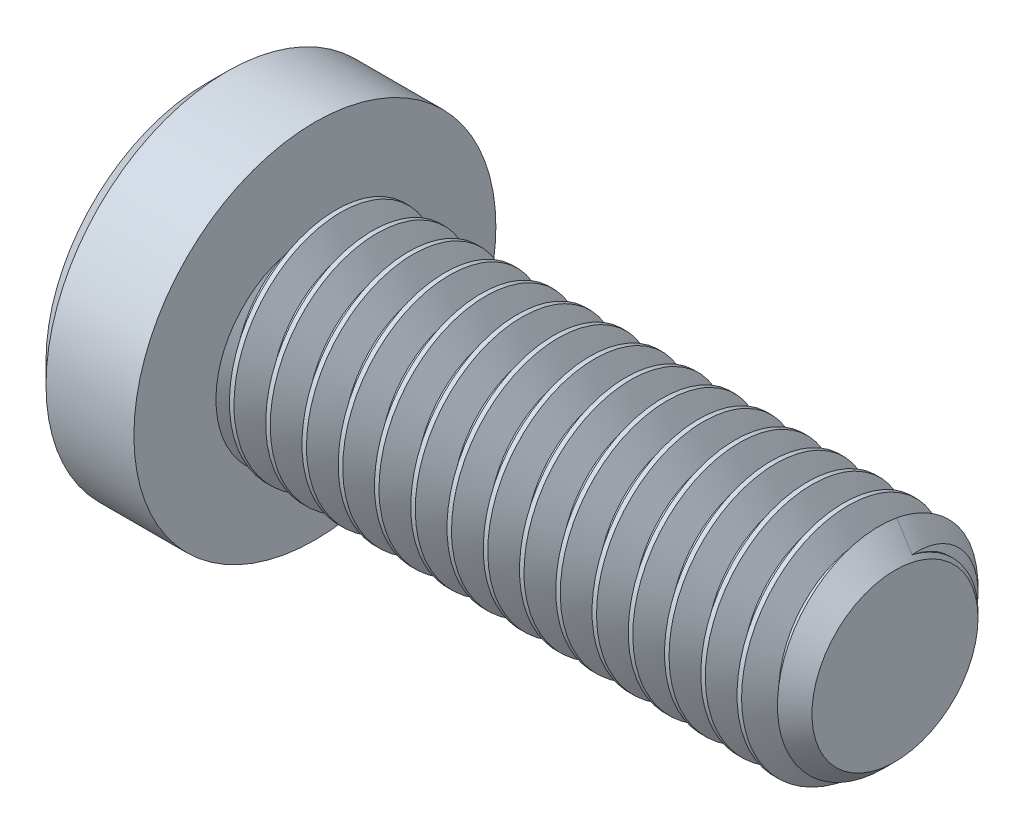
from build123d import *

# Parameters (mm, degrees)
SKETCH2_R           = 2.413
BOSS_EXTRUDE1_DEPTH = 12.7
CHAMFER1_SIZE       = 0.5953125
CUT_SWEEP1_PITCH    = 0.79375
CUT_EXTRUDE1_DEPTH  = 1.8288


with BuildPart() as part:
    # Sketch2 → Boss-Extrude1 (new body)
    with BuildSketch(Plane(origin=(6.35, 0, 0), x_dir=(0, 0, -1), z_dir=(1, 0, 0))):
        Circle(SKETCH2_R)
    extrude(amount=-BOSS_EXTRUDE1_DEPTH)

    # Chamfer1
    chamfer1_edges = [part.edges().sort_by_distance(p)[0] for p in [
        (6.35, 0, 2.413),
    ]]
    chamfer(chamfer1_edges, length=CHAMFER1_SIZE)

    # Cut-Sweep1: the profile of Sketch5 profile screwed along a right-hand helix of 17 turns, 8 arcs to a turn; built about Z, then put on its axis
    cut_sweep1_z = Axis((0, 0, 0), (0, 0, 1))
    cut_sweep1_corners = [(2.4133, 0, 0.34743883), (2.4133, 0, -0.34743883), (1.897444252, 0, -0.049609375), (1.897444252, 0, 0.049609375)]
    with BuildLine(mode=Mode.PRIVATE) as cut_sweep1_profile:
        Line(cut_sweep1_corners[0], cut_sweep1_corners[1])
        Line(cut_sweep1_corners[1], cut_sweep1_corners[2])
        Line(cut_sweep1_corners[2], cut_sweep1_corners[3])
        Line(cut_sweep1_corners[3], cut_sweep1_corners[0])
    cut_sweep1_cap = Face(cut_sweep1_profile.wire())
    cut_sweep1_turn_angles = [0, 22.5, 45, 67.5, 90, 112.5, 135, 157.5, 180, 202.5, 225, 247.5, 270, 292.5, 315, 337.5, 360]
    cut_sweep1_turn_weights = [1, 0.9238795325112867, 1, 0.9238795325112867, 1, 0.9238795325112867, 1, 0.9238795325112867, 1, 0.9238795325112867, 1, 0.9238795325112867, 1, 0.9238795325112867, 1, 0.9238795325112867, 1]
    cut_sweep1_turn_rails = [Edge.make_bspline([Vector(p[0], p[1], 0).rotate(cut_sweep1_z, cut_sweep1_turn_angles[k]) / cut_sweep1_turn_weights[k] + Vector(0, 0, p[2] + CUT_SWEEP1_PITCH * cut_sweep1_turn_angles[k] / 360) for k in range(17)], [0, 0, 0, 1, 1, 2, 2, 3, 3, 4, 4, 5, 5, 6, 6, 7, 7, 8, 8, 8], 2, cut_sweep1_turn_weights) for p in cut_sweep1_corners]
    cut_sweep1_turn_sides = [Face.make_surface_from_curves(cut_sweep1_turn_rails[p[0]], cut_sweep1_turn_rails[p[1]]) for p in [(0, 1), (1, 2), (2, 3), (3, 0)]]
    cut_sweep1 = Plane(origin=(6.35, 0, 0), x_dir=(0, 1, 0), z_dir=(-1, 0, 0)) * Solid(Shell([*[p.moved(Location((0, 0, CUT_SWEEP1_PITCH * i))) for i in range(17) for p in cut_sweep1_turn_sides], cut_sweep1_cap, cut_sweep1_cap.rotate(cut_sweep1_z, 6120).moved(Location((0, 0, CUT_SWEEP1_PITCH * 6120 / 360)))]))
    add(cut_sweep1, mode=Mode.SUBTRACT)

    # Sketch6 → Revolve1 (revolve)
    with BuildSketch(Plane.XY, mode=Mode.PRIVATE) as revolve1_sk:
        Polygon((-8.27405, 3.9624), (-8.73125, 3.5052), (-8.73125, 0), (-6.35, 0), (-6.35, 3.9624), align=None)
    revolve(revolve1_sk.sketch.rotate(Axis((-6.35, 0, 0), (-1, 0, 0)), 13.865622854), axis=Axis((-6.35, 0, 0), (-1, 0, 0)))

    # Sketch4 → Cut-Extrude1 (cut)
    with BuildSketch(Plane(origin=(-8.73125, 0, 0), x_dir=(0, 0, -1), z_dir=(1, 0, 0))):
        Polygon((0, 1.374815329), (-1.190625, 0.687407664), (-1.190625, -0.687407664), (0, -1.374815329), (1.190625, -0.687407664), (1.190625, 0.687407664), align=None)
    extrude(amount=CUT_EXTRUDE1_DEPTH, mode=Mode.SUBTRACT)

    # Cut-Extrude2 cone 1 section (through the dimple's axis) → Cut-Extrude2 (revolve, cut)
    with BuildSketch(Plane(origin=(-8.73125, 0, 0), x_dir=(0, 0, 1), z_dir=(0, 1, 0))):
        Polygon((0, 0), (1.374815329, 0), (0, 1.374815329), align=None)
    revolve(axis=Axis((-8.73125, 0, 0), (1, 0, 0)), mode=Mode.SUBTRACT)


solid = part.part
